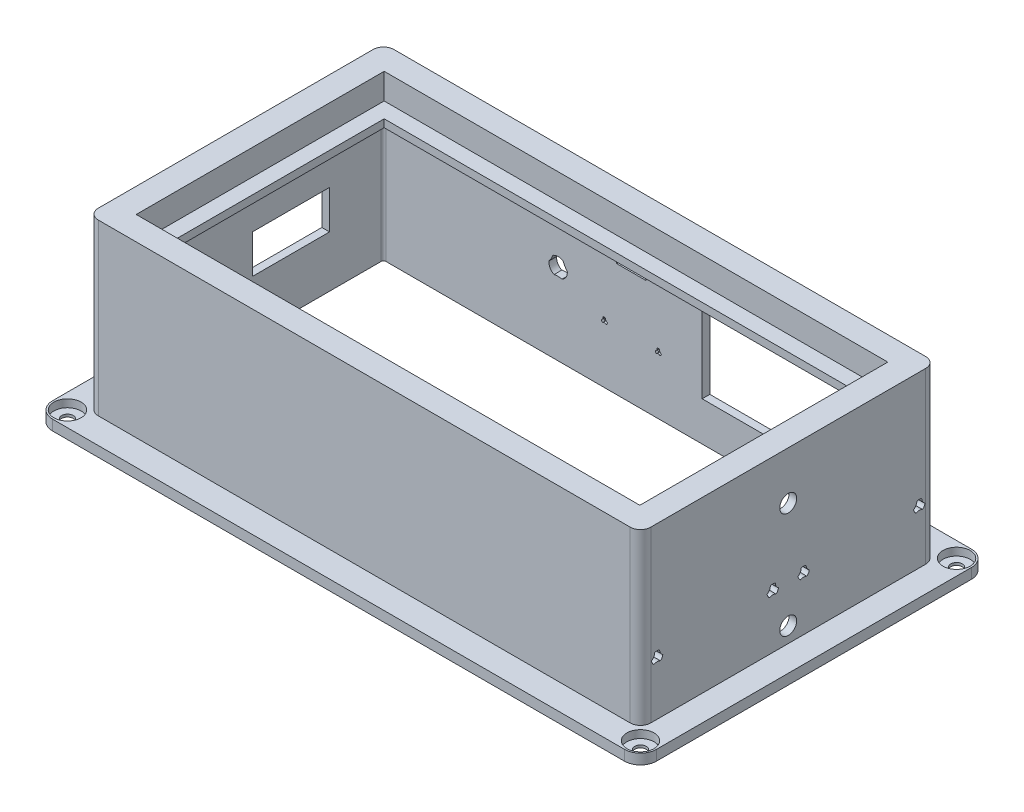
from build123d import *

# Parameters (mm, degrees)
BOSS_EXTRU_1_DEPTH                                 = 60
COQUE1_T                                           = -3
BOSS_EXTRU_2_OUTLINE_W                             = 196
BOSS_EXTRU_2_OUTLINE_H                             = 96.5
BOSS_EXTRU_2_DEPTH                                 = 10
ESQUISSE3_W                                        = 71
ESQUISSE3_H                                        = 39.5
ESQUISSE3_W_2                                      = 11.5
ESQUISSE3_H_2                                      = 4
ENL_V_MAT_EXTRU_1_DEPTH                            = 3
ESQUISSE3_4_W                                      = 25.2
ESQUISSE3_4_H                                      = 27.8
ENL_V_MAT_EXTRU_2_DEPTH                            = 2
ESQUISSE5_W                                        = 184
ESQUISSE5_H                                        = 84.5
ENL_V_MAT_EXTRU_3_DEPTH                            = 3
ENL_V_MAT_EXTRU_4_REACH                            = 235.305
ESQUISSE8_W                                        = 30
ESQUISSE8_H                                        = 15
ESQUISSE9_W                                        = 209
ESQUISSE9_H                                        = 109
BOSS_EXTRU_4_DEPTH                                 = 4
CHAMBRAGE_POUR_VIS_T_TE_HEXAGONALE_M41_D           = 4.5
CHAMBRAGE_POUR_VIS_T_TE_HEXAGONALE_M41_CBORE_D     = 10.59
CHAMBRAGE_POUR_VIS_T_TE_HEXAGONALE_M41_CBORE_DEPTH = 3
ENL_V_MAT_EXTRU_5_DEPTH                            = 3
D_GAGEMENT_M61_D                                   = 6.6
D_GAGEMENT_M61_DEPTH                               = 3


# Read off the part's stored shape, not the designer's step: Boss.-Extru.2
with BuildPart() as part:
    # Esquisse1 → Boss.-Extru.1 (new body)
    with BuildSketch(Plane(origin=(0, 0, 0), x_dir=(1, 0, 0), z_dir=(0, 1, 0))):
        with BuildLine():
            Line((-103.5, 57.5), (103.5, 57.5))
            ThreePointArc((103.5, 57.5), (106.328427125, 56.328427125), (107.5, 53.5))
            Line((107.5, 53.5), (107.5, -53.5))
            ThreePointArc((107.5, -53.5), (106.328427125, -56.328427125), (103.5, -57.5))
            Line((103.5, -57.5), (-103.5, -57.5))
            ThreePointArc((-103.5, -57.5), (-106.328427125, -56.328427125), (-107.5, -53.5))
            Line((-107.5, -53.5), (-107.5, 53.5))
            ThreePointArc((-107.5, 53.5), (-106.328427125, 56.328427125), (-103.5, 57.5))
        make_face()
    extrude(amount=BOSS_EXTRU_1_DEPTH)

    # Coque1
    coque1_openings = [part.faces().sort_by_distance(p)[0] for p in [
        (0, 0, 0),
    ]]
    offset(amount=COQUE1_T, openings=coque1_openings, kind=Kind.INTERSECTION)

    # Boss.-Extru.2 outline → Boss.-Extru.2 (add)
    with BuildSketch(Plane(origin=(0, 60, 0), x_dir=(1, 0, 0), z_dir=(0, 1, 0))):
        with BuildLine():
            ThreePointArc((-103.5, 57.5), (-106.328427125, 56.328427125), (-107.5, 53.5))
            Line((-107.5, 53.5), (-107.5, -53.5))
            ThreePointArc((-107.5, -53.5), (-106.328427125, -56.328427125), (-103.5, -57.5))
            Line((-103.5, -57.5), (103.5, -57.5))
            ThreePointArc((103.5, -57.5), (106.328427125, -56.328427125), (107.5, -53.5))
            Line((107.5, -53.5), (107.5, 53.5))
            ThreePointArc((107.5, 53.5), (106.328427125, 56.328427125), (103.5, 57.5))
            Line((103.5, 57.5), (-103.5, 57.5))
        make_face()
        Rectangle(BOSS_EXTRU_2_OUTLINE_W, BOSS_EXTRU_2_OUTLINE_H, mode=Mode.SUBTRACT)
    extrude(amount=BOSS_EXTRU_2_DEPTH)

    # Esquisse3 → Enlèv. mat.-Extru.1 (cut)
    with BuildSketch(Plane(origin=(0, 0, -57.5), x_dir=(-1, 0, 0), z_dir=(0, 0, -1))):
        with Locations((-55, 35)):
            Rectangle(ESQUISSE3_W, ESQUISSE3_H)
        with Locations((8.072937115, 46.188484734)):
            Rectangle(ESQUISSE3_W_2, ESQUISSE3_H_2)
        with BuildLine():
            ThreePointArc((38.117871013, 28.332487519), (39.61171058, 29.660770737), (40.166695713, 31.581157276))
            ThreePointArc((40.166695713, 31.581157276), (40.163949212, 31.721753371), (40.155713901, 31.862134939))
            ThreePointArc((40.155713901, 31.862134939), (39.251374465, 33.131157276), (38.604538601, 34.54884937))
            ThreePointArc((38.604538601, 34.54884937), (36.566695713, 35.181157276), (34.528852825, 34.54884937))
            ThreePointArc((34.528852825, 34.54884937), (33.882016961, 33.131157276), (32.977677525, 31.862134939))
            ThreePointArc((32.977677525, 31.862134939), (33.449004259, 29.781157276), (35.015520413, 28.332487519))
            ThreePointArc((35.015520413, 28.332487519), (36.566695713, 28.481157276), (38.117871013, 28.332487519))
        make_face()
        with BuildLine():
            ThreePointArc((-1.233296382, 45.916330985), (-1.820845102, 46.388484734), (-1.935967883, 47.133393726))
            ThreePointArc((-1.935967883, 47.133393726), (-2.427062885, 47.238484734), (-2.918157886, 47.133393726))
            ThreePointArc((-2.918157886, 47.133393726), (-3.033280667, 46.388484734), (-3.620829387, 45.916330985))
            ThreePointArc((-3.620829387, 45.916330985), (-3.466293369, 45.438484734), (-3.129734385, 45.065729492))
            ThreePointArc((-3.129734385, 45.065729492), (-2.427062885, 45.338484734), (-1.724391384, 45.065729492))
            ThreePointArc((-1.724391384, 45.065729492), (-1.3878324, 45.438484734), (-1.233296382, 45.916330985))
        make_face()
        with BuildLine():
            ThreePointArc((17.379170613, 45.916330985), (17.533706631, 45.438484734), (17.870265615, 45.065729492))
            ThreePointArc((17.870265615, 45.065729492), (18.572937115, 45.338484734), (19.275608616, 45.065729492))
            ThreePointArc((19.275608616, 45.065729492), (19.6121676, 45.438484734), (19.766703618, 45.916330985))
            ThreePointArc((19.766703618, 45.916330985), (19.179154898, 46.388484734), (19.064032117, 47.133393726))
            ThreePointArc((19.064032117, 47.133393726), (18.572937115, 47.238484734), (18.081842114, 47.133393726))
            ThreePointArc((18.081842114, 47.133393726), (17.966719333, 46.388484734), (17.379170613, 45.916330985))
        make_face()
        with BuildLine():
            ThreePointArc((-1.233296382, 22.416330985), (-1.820845102, 22.888484734), (-1.935967883, 23.633393726))
            ThreePointArc((-1.935967883, 23.633393726), (-2.427062885, 23.738484734), (-2.918157886, 23.633393726))
            ThreePointArc((-2.918157886, 23.633393726), (-3.033280667, 22.888484734), (-3.620829387, 22.416330985))
            ThreePointArc((-3.620829387, 22.416330985), (-3.466293369, 21.938484734), (-3.129734385, 21.565729492))
            ThreePointArc((-3.129734385, 21.565729492), (-2.427062885, 21.838484734), (-1.724391384, 21.565729492))
            ThreePointArc((-1.724391384, 21.565729492), (-1.3878324, 21.938484734), (-1.233296382, 22.416330985))
        make_face()
        with BuildLine():
            ThreePointArc((19.766703618, 22.416330985), (19.179154898, 22.888484734), (19.064032117, 23.633393726))
            ThreePointArc((19.064032117, 23.633393726), (18.572937115, 23.738484734), (18.081842114, 23.633393726))
            ThreePointArc((18.081842114, 23.633393726), (17.966719333, 22.888484734), (17.379170613, 22.416330985))
            ThreePointArc((17.379170613, 22.416330985), (17.533706631, 21.938484734), (17.870265615, 21.565729492))
            ThreePointArc((17.870265615, 21.565729492), (18.572937115, 21.838484734), (19.275608616, 21.565729492))
            ThreePointArc((19.275608616, 21.565729492), (19.6121676, 21.938484734), (19.766703618, 22.416330985))
        make_face()
    extrude(amount=-ENL_V_MAT_EXTRU_1_DEPTH, mode=Mode.SUBTRACT)

    # Esquisse3<4> → Enlèv. mat.-Extru.2 (cut)
    with BuildSketch(Plane(origin=(0, 0, -57.5), x_dir=(-1, 0, 0), z_dir=(0, 0, -1))):
        with Locations((8.072937115, 34.288484734)):
            Rectangle(ESQUISSE3_4_W, ESQUISSE3_4_H)
    extrude(amount=-ENL_V_MAT_EXTRU_2_DEPTH, mode=Mode.SUBTRACT)

    # Esquisse5 → Enlèv. mat.-Extru.3 (cut)
    with BuildSketch(Plane(origin=(0, 60, 0), x_dir=(1, 0, 0), z_dir=(0, 1, 0))):
        Rectangle(ESQUISSE5_W, ESQUISSE5_H)
    extrude(amount=-ENL_V_MAT_EXTRU_3_DEPTH, mode=Mode.SUBTRACT)

    # Esquisse8 → Enlèv. mat.-Extru.4 (cut, up to next)
    with BuildSketch(Plane.ZY.offset(107.5), mode=Mode.PRIVATE) as enl_v_mat_extru_4_sk1:
        with Locations((-18.5, 27.5)):
            Rectangle(ESQUISSE8_W, ESQUISSE8_H)
    enl_v_mat_extru_4_tool1 = extrude(enl_v_mat_extru_4_sk1.sketch, amount=-ENL_V_MAT_EXTRU_4_REACH, mode=Mode.PRIVATE) & part.part
    add(enl_v_mat_extru_4_tool1.solids().sort_by_distance((-107.5, 27.5, -18.5))[0], mode=Mode.SUBTRACT)

    # Esquisse9 → Boss.-Extru.4 (add)
    with BuildSketch(Plane.XZ):
        with BuildLine():
            Line((111.3, -67.5), (-111.3, -67.5))
            ThreePointArc((-111.3, -67.5), (-115.684062043, -65.684062043), (-117.5, -61.3))
            Line((-117.5, -61.3), (-117.5, 61.3))
            ThreePointArc((-117.5, 61.3), (-115.684062043, 65.684062043), (-111.3, 67.5))
            Line((-111.3, 67.5), (111.3, 67.5))
            ThreePointArc((111.3, 67.5), (115.684062043, 65.684062043), (117.5, 61.3))
            Line((117.5, 61.3), (117.5, -61.3))
            ThreePointArc((117.5, -61.3), (115.684062043, -65.684062043), (111.3, -67.5))
        make_face()
        Rectangle(ESQUISSE9_W, ESQUISSE9_H, mode=Mode.SUBTRACT)
    extrude(amount=-BOSS_EXTRU_4_DEPTH)

    # Chambrage pour vis à tête hexagonale M41 (through all)
    with Locations(Plane(origin=(0, 4, 0), x_dir=(1, 0, 0), z_dir=(0, 1, 0))):
        with Locations((-111.5, 61.5), (111.5, 61.5), (111.5, -61.5), (-111.5, -61.5)):
            CounterBoreHole(CHAMBRAGE_POUR_VIS_T_TE_HEXAGONALE_M41_D / 2, CHAMBRAGE_POUR_VIS_T_TE_HEXAGONALE_M41_CBORE_D / 2, CHAMBRAGE_POUR_VIS_T_TE_HEXAGONALE_M41_CBORE_DEPTH)

    # Esquisse13 → Enlèv. mat.-Extru.5 (cut)
    with BuildSketch(Plane(origin=(107.5, 0, 0), x_dir=(0, 0, -1), z_dir=(1, 0, 0))):
        with BuildLine():
            ThreePointArc((8.193649051, 24.74946516), (7.299038106, 25.666509594), (6.952159802, 26.899787616))
            ThreePointArc((6.952159802, 26.899787616), (6, 27.116509594), (5.047840198, 26.899787616))
            ThreePointArc((5.047840198, 26.899787616), (4.700961894, 25.666509594), (3.806350949, 24.74946516))
            ThreePointArc((3.806350949, 24.74946516), (4.094744112, 23.816509594), (4.758510751, 23.100276006))
            ThreePointArc((4.758510751, 23.100276006), (6, 23.416509594), (7.241489249, 23.100276006))
            ThreePointArc((7.241489249, 23.100276006), (7.905255888, 23.816509594), (8.193649051, 24.74946516))
        make_face()
        with BuildLine():
            ThreePointArc((51.952159802, 26.899787616), (51, 27.116509594), (50.047840198, 26.899787616))
            ThreePointArc((50.047840198, 26.899787616), (49.700961894, 25.666509594), (48.806350949, 24.74946516))
            ThreePointArc((48.806350949, 24.74946516), (49.094744112, 23.816509594), (49.758510751, 23.100276006))
            ThreePointArc((49.758510751, 23.100276006), (51, 23.416509594), (52.241489249, 23.100276006))
            ThreePointArc((52.241489249, 23.100276006), (52.905255888, 23.816509594), (53.193649051, 24.74946516))
            ThreePointArc((53.193649051, 24.74946516), (52.299038106, 25.666509594), (51.952159802, 26.899787616))
        make_face()
        with BuildLine():
            ThreePointArc((-48.806350949, 24.74946516), (-49.700961894, 25.666509594), (-50.047840198, 26.899787616))
            ThreePointArc((-50.047840198, 26.899787616), (-51, 27.116509594), (-51.952159802, 26.899787616))
            ThreePointArc((-51.952159802, 26.899787616), (-52.299038106, 25.666509594), (-53.193649051, 24.74946516))
            ThreePointArc((-53.193649051, 24.74946516), (-52.905255888, 23.816509594), (-52.241489249, 23.100276006))
            ThreePointArc((-52.241489249, 23.100276006), (-51, 23.416509594), (-49.758510751, 23.100276006))
            ThreePointArc((-49.758510751, 23.100276006), (-49.094744112, 23.816509594), (-48.806350949, 24.74946516))
        make_face()
        with BuildLine():
            ThreePointArc((-5.047840198, 26.899787616), (-6, 27.116509594), (-6.952159802, 26.899787616))
            ThreePointArc((-6.952159802, 26.899787616), (-7.299038106, 25.666509594), (-8.193649051, 24.74946516))
            ThreePointArc((-8.193649051, 24.74946516), (-7.905255888, 23.816509594), (-7.241489249, 23.100276006))
            ThreePointArc((-7.241489249, 23.100276006), (-6, 23.416509594), (-4.758510751, 23.100276006))
            ThreePointArc((-4.758510751, 23.100276006), (-4.094744112, 23.816509594), (-3.806350949, 24.74946516))
            ThreePointArc((-3.806350949, 24.74946516), (-4.700961894, 25.666509594), (-5.047840198, 26.899787616))
        make_face()
    extrude(amount=-ENL_V_MAT_EXTRU_5_DEPTH, mode=Mode.SUBTRACT)

    # Dégagement M61
    with Locations(Plane(origin=(107.5, 0, 0), x_dir=(0, 0, -1), z_dir=(1, 0, 0))):
        with Locations((0, 51.309466908), (0, 10.031656552)):
            Hole(D_GAGEMENT_M61_D / 2, depth=D_GAGEMENT_M61_DEPTH)


solid = part.part
